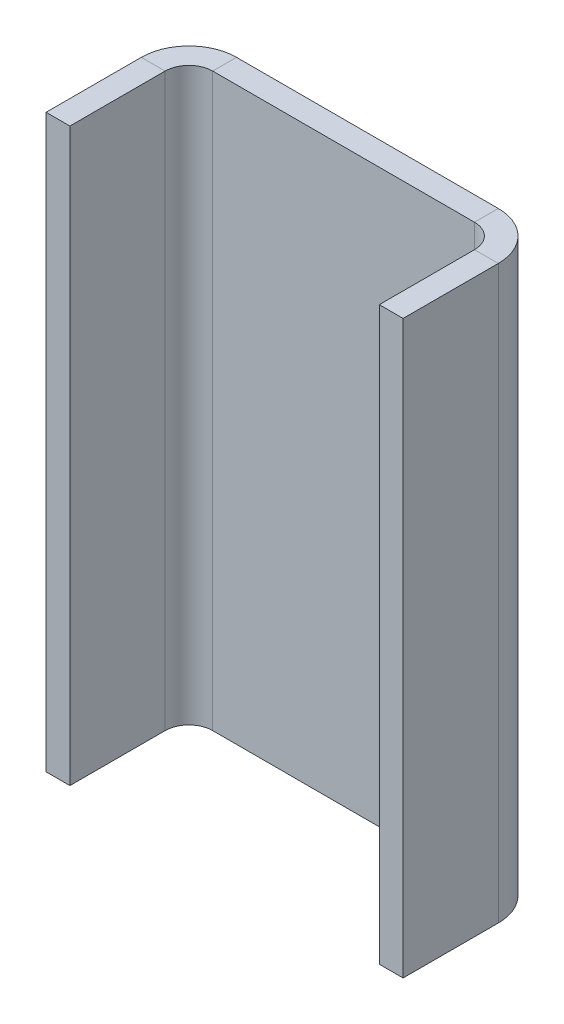
from build123d import *

# Parameters (mm, degrees)
SKETCH1_W                    = 65
SKETCH1_H                    = 120
BASE_FLANGE1_DEPTH           = 5
EDGE_FLANGE1_STRIP_W         = 30
EDGE_FLANGE1_STRIP_H         = 5
EDGE_FLANGE1_STRIP_CUT_DEPTH = 120
EDGE_FLANGE1_DEPTH           = 120
EDGE_FLANGE2_STRIP_W         = 30
EDGE_FLANGE2_STRIP_H         = 5
EDGE_FLANGE2_STRIP_CUT_DEPTH = 120
EDGE_FLANGE2_DEPTH           = 120


# Sheet-metal steps are written as plain solids
with BuildPart() as part:
    # Sketch1 → Base-Flange1 (new body)
    with BuildSketch(Plane.XY):
        with Locations((0, -60)):
            Rectangle(SKETCH1_W, SKETCH1_H)
    extrude(amount=-BASE_FLANGE1_DEPTH)

    # Edge-Flange1 strip (across the edge) → Edge-Flange1 strip cut (cut)
    with BuildSketch(Plane(origin=(32.5, -120, 0), x_dir=(-1, 0, 0), z_dir=(0, 1, 0))):
        with Locations((-10, -2.5)):
            Rectangle(EDGE_FLANGE1_STRIP_W, EDGE_FLANGE1_STRIP_H)
    extrude(amount=EDGE_FLANGE1_STRIP_CUT_DEPTH, mode=Mode.SUBTRACT)

    # Edge-Flange1 section (across the edge) → Edge-Flange1 (add)
    with BuildSketch(Plane(origin=(32.5, -120, 0), x_dir=(-1, 0, 0), z_dir=(0, 1, 0))):
        with BuildLine():
            Line((-5, 5), (-5, 25))
            Line((-5, 25), (0, 25))
            Line((0, 25), (0, 5))
            ThreePointArc((0, 5), (1.464466094, 1.464466094), (5, 0))
            Line((5, 0), (5, -5))
            ThreePointArc((5, -5), (-2.071067812, -2.071067812), (-5, 5))
        make_face()
    extrude(amount=EDGE_FLANGE1_DEPTH)

    # Edge-Flange2 strip (across the edge) → Edge-Flange2 strip cut (cut)
    with BuildSketch(Plane(origin=(-32.5, 0, 0), x_dir=(1, 0, 0), z_dir=(0, -1, 0))):
        with Locations((-10, -2.5)):
            Rectangle(EDGE_FLANGE2_STRIP_W, EDGE_FLANGE2_STRIP_H)
    extrude(amount=EDGE_FLANGE2_STRIP_CUT_DEPTH, mode=Mode.SUBTRACT)

    # Edge-Flange2 section (across the edge) → Edge-Flange2 (add)
    with BuildSketch(Plane(origin=(-32.5, 0, 0), x_dir=(1, 0, 0), z_dir=(0, -1, 0))):
        with BuildLine():
            Line((-5, 5), (-5, 25))
            Line((-5, 25), (0, 25))
            Line((0, 25), (0, 5))
            ThreePointArc((0, 5), (1.464466094, 1.464466094), (5, 0))
            Line((5, 0), (5, -5))
            ThreePointArc((5, -5), (-2.071067812, -2.071067812), (-5, 5))
        make_face()
    extrude(amount=EDGE_FLANGE2_DEPTH)


solid = part.part
